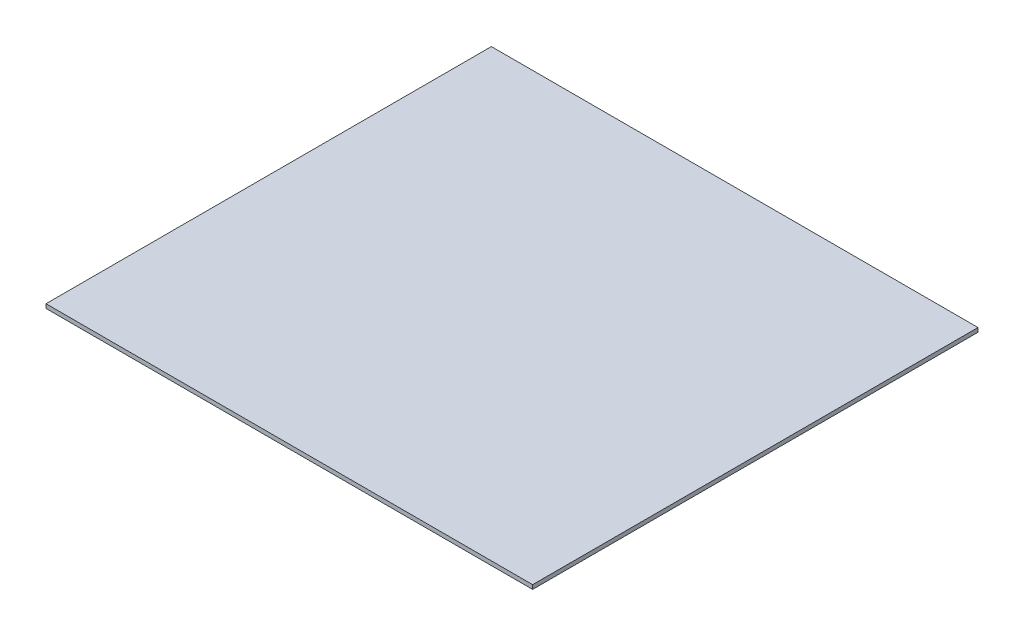
from build123d import *

# Parameters (mm, degrees)
SKETCH1_W           = 374.65
SKETCH1_H           = 342.9
BOSS_EXTRUDE1_DEPTH = 3.175


with BuildPart() as part:
    # Sketch1 → Boss-Extrude1 (new body)
    with BuildSketch(Plane(origin=(0, 0, 0), x_dir=(1, 0, 0), z_dir=(0, 1, 0))):
        Rectangle(SKETCH1_W, SKETCH1_H)
    extrude(amount=BOSS_EXTRUDE1_DEPTH)


solid = part.part
